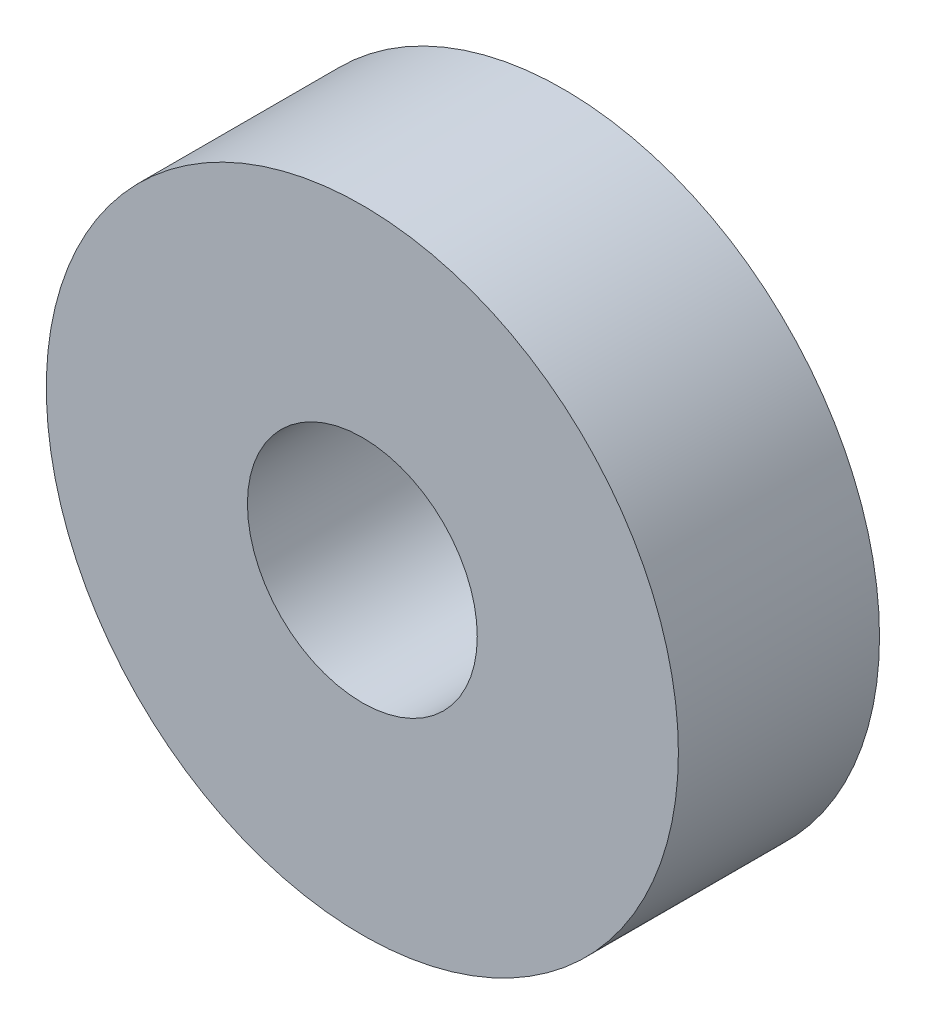
from build123d import *

# Parameters (mm, degrees)
SKETCH1_R                = 11
BOSS_EXTRUDE1_DEPTH      = 7
F_8_0_8_DIAMETER_HOLE1_D = 8


with BuildPart() as part:
    # Sketch1 → Boss-Extrude1 (new body)
    with BuildSketch(Plane.XY.offset(7)):
        Circle(SKETCH1_R)
    extrude(amount=-BOSS_EXTRUDE1_DEPTH)

    # Ø8.0 (8) Diameter Hole1 (through all)
    with Locations(Plane.XY.offset(7)):
        with Locations((0, 0)):
            Hole(F_8_0_8_DIAMETER_HOLE1_D / 2)


solid = part.part
